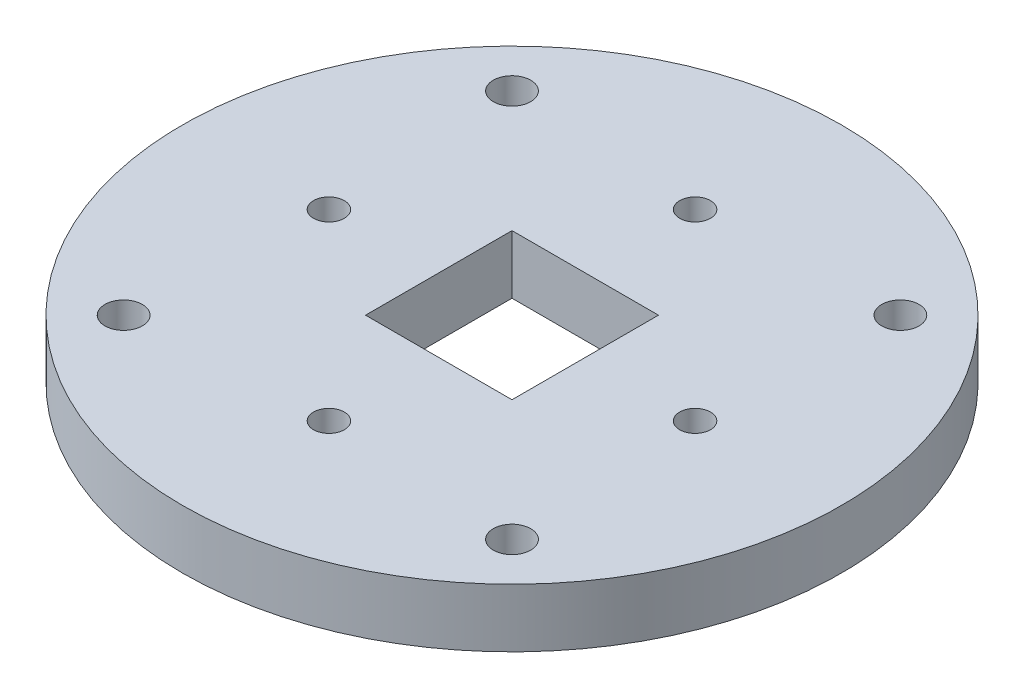
from build123d import *

# Parameters (mm, degrees)
SKETCH1_R           = 45
BOSS_EXTRUDE1_DEPTH = 8
SKETCH3_R           = 2.1
CUT_EXTRUDE2_DEPTH  = 65.140470843
CIRPATTERN1_COUNT   = 4
SKETCH4_W           = 20
SKETCH4_H           = 20
CUT_EXTRUDE3_DEPTH  = 10
SKETCH6_R           = 2.55
CUT_EXTRUDE4_DEPTH  = 65.140470843


with BuildPart() as part:
    # Sketch1 → Boss-Extrude1 (new body)
    with BuildSketch(Plane(origin=(0, 0, 0), x_dir=(1, 0, 0), z_dir=(0, 1, 0))):
        Circle(SKETCH1_R)
    extrude(amount=BOSS_EXTRUDE1_DEPTH)

    # Sketch3 → Cut-Extrude2 (cut, through all)
    with BuildSketch(Plane(origin=(0, 8, 0), x_dir=(1, 0, 0), z_dir=(0, 1, 0))):
        with Locations((0, 25)):
            Circle(SKETCH3_R)
    cut_extrude2 = extrude(amount=-CUT_EXTRUDE2_DEPTH, mode=Mode.SUBTRACT)

    # CirPattern1: Cut-Extrude2 ×4 about axis
    cirpattern1_axis = Axis((0, 8, 0), (0, -1, 0))
    for i in range(1, CIRPATTERN1_COUNT):
        add(cut_extrude2.rotate(cirpattern1_axis, i * 360 / CIRPATTERN1_COUNT), mode=Mode.SUBTRACT)

    # Sketch4 → Cut-Extrude3 (cut)
    with BuildSketch(Plane(origin=(0, 8, 0), x_dir=(1, 0, 0), z_dir=(0, 1, 0))):
        Rectangle(SKETCH4_W, SKETCH4_H)
    extrude(amount=-CUT_EXTRUDE3_DEPTH, mode=Mode.SUBTRACT)

    # Sketch6 → Cut-Extrude4 (cut, through all)
    with BuildSketch(Plane(origin=(0, 8, 0), x_dir=(1, 0, 0), z_dir=(0, 1, 0))):
        with Locations((-26.516504294, 26.516504294)):
            Circle(SKETCH6_R)
        with Locations((26.516504294, 26.516504294)):
            Circle(SKETCH6_R)
        with Locations((26.516504294, -26.516504294)):
            Circle(SKETCH6_R)
        with Locations((-26.516504294, -26.516504294)):
            Circle(SKETCH6_R)
    extrude(amount=-CUT_EXTRUDE4_DEPTH, mode=Mode.SUBTRACT)


solid = part.part
